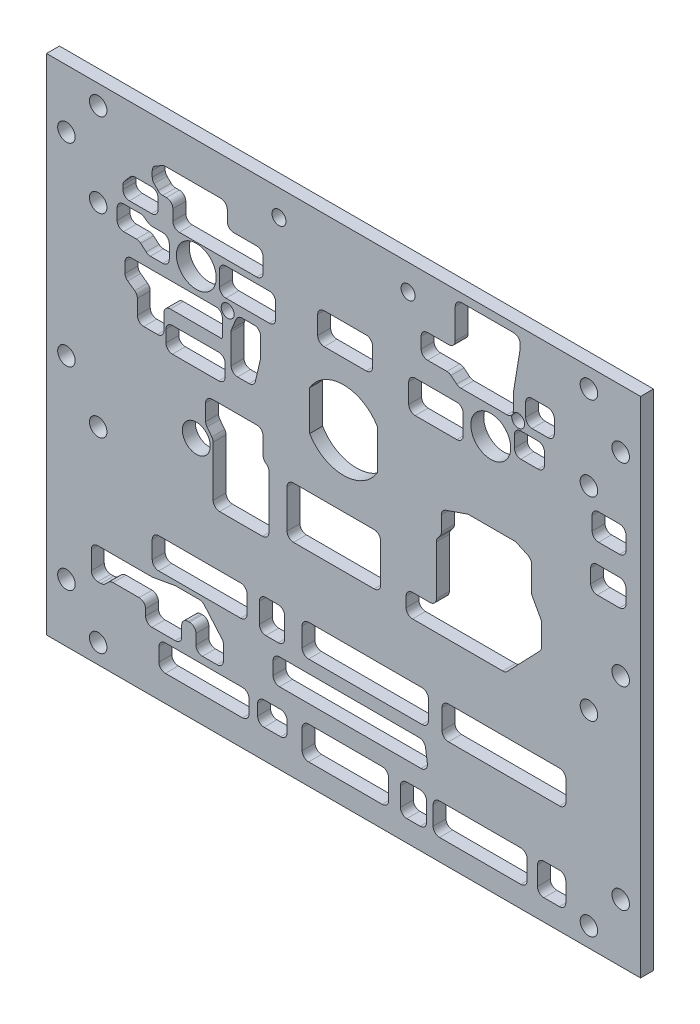
from build123d import *

# Parameters (mm, degrees)
SKETCH1_W                = 146.05
SKETCH1_H                = 123.825
BOSS_EXTRUDE1_DEPTH      = 3.175
F_6_CLEARANCE_HOLE1_D    = 4.3053
SKETCH4_R                = 4.9022
SKETCH4_R_2              = 3.7703125
SKETCH4_R_3              = 3.429
SKETCH4_R_4              = 1.125
SKETCH4_R_5              = 1.5875
SWITCH_MOUNT_HOLES_DEPTH = 192.502777395
F_4_CLEARANCE_HOLE1_D    = 3.4544
CUT_EXTRUDE1_DEPTH       = 192.502777395
CUT_EXTRUDE1_DEPTH_BACK  = 192.502777395


with BuildPart() as part:
    # Sketch1 → Boss-Extrude1 (new body)
    with BuildSketch(Plane.XY):
        with Locations((-73.025, 61.9125)):
            Rectangle(SKETCH1_W, SKETCH1_H)
    extrude(amount=-BOSS_EXTRUDE1_DEPTH)

    # #6 Clearance Hole1 (through all)
    with Locations(Plane(origin=(0, 0, -3.175), x_dir=(-1, 0, 0), z_dir=(0, 0, -1))):
        with Locations((12.7, 119.0625), (133.35, 119.0625), (141.1605, 109.5375), (133.35, 98.425), (141.1605, 61.9125), (133.35, 50.673), (133.35, 4.7625), (12.7, 4.7625), (12.7, 50.673), (12.7, 98.425), (4.8895, 109.5375), (141.1605, 14.2875), (4.8895, 14.2875), (4.8895, 61.9125)):
            Hole(F_6_CLEARANCE_HOLE1_D / 2)

    # Sketch4 → Switch Mount Holes (cut, through all)
    with BuildSketch(Plane(origin=(0, 0, -3.175), x_dir=(-1, 0, 0), z_dir=(0, 0, -1))):
        with Locations((36.83, 96.901)):
            Circle(SKETCH4_R)
        with Locations((36.83, 60.325)):
            Circle(SKETCH4_R_2)
        with Locations((109.22, 60.325)):
            Circle(SKETCH4_R_3)
        with Locations((109.22, 96.901)):
            Circle(SKETCH4_R)
        with Locations((36.830000027, 66.525)):
            Circle(SKETCH4_R_4)
        with Locations((101.514113129, 91.302345472)):
            Circle(SKETCH4_R_5)
        with Locations((30.094807909, 103.636192091)):
            Circle(SKETCH4_R_5)
        with BuildLine():
            Line((81.3435, 85.032269324), (81.3435, 75.241730676))
            ThreePointArc((81.3435, 75.241730676), (73.025, 70.485), (64.7065, 75.241730676))
            Line((64.7065, 75.241730676), (64.7065, 85.032269324))
            ThreePointArc((64.7065, 85.032269324), (73.025, 89.789), (81.3435, 85.032269324))
        make_face()
    extrude(amount=-SWITCH_MOUNT_HOLES_DEPTH, mode=Mode.SUBTRACT)

    # #4 Clearance Hole1 (through all)
    with Locations(Plane.XY):
        with Locations((-88.9, 117.475), (-57.15, 117.475)):
            Hole(F_4_CLEARANCE_HOLE1_D / 2)

    # Sketch7 → Cut-Extrude1 (cut, two sides: drawn at the far end of the back side and taken through both)
    with BuildSketch(Plane(origin=(0, 0, -3.175), x_dir=(-1, 0, 0), z_dir=(0, 0, -1)).offset(-CUT_EXTRUDE1_DEPTH_BACK)):
        with BuildLine():
            Line((50.18834912, 55.657636326), (50.18834912, 67.777242905))
            ThreePointArc((50.18834912, 67.777242905), (50.107046721, 68.278765624), (49.871467182, 68.728918264))
            Line((49.871467182, 68.728918264), (49.27420426, 69.526346767))
            ThreePointArc((49.27420426, 69.526346767), (49.038624722, 69.976499407), (48.957322323, 70.478022126))
            Line((48.957322323, 70.478022126), (48.957322323, 74.149631653))
            ThreePointArc((48.957322323, 74.149631653), (48.662982402, 75.070442849), (47.889110343, 75.649797045))
            Line((47.889110343, 75.649797045), (42.669307529, 77.456651865))
            ThreePointArc((42.669307529, 77.456651865), (42.413309929, 77.522000575), (42.150019509, 77.543986473))
            Line((42.150019509, 77.543986473), (31.103079312, 77.543986473))
            ThreePointArc((31.103079312, 77.543986473), (30.770451883, 77.508747805), (30.452591507, 77.404596229))
            Line((30.452591507, 77.404596229), (27.739916618, 76.186068472))
            ThreePointArc((27.739916618, 76.186068472), (27.057586798, 75.60037012), (26.802904423, 74.737958716))
            Line((26.802904423, 74.737958716), (26.802904423, 68.713762689))
            ThreePointArc((26.802904423, 68.713762689), (26.752954373, 68.31867232), (26.606247542, 67.948444671))
            Line((26.606247542, 67.948444671), (24.53833852, 64.190350695))
            ThreePointArc((24.53833852, 64.190350695), (24.391631688, 63.820123046), (24.341681639, 63.425032677))
            Line((24.341681639, 63.425032677), (24.341681639, 58.319523275))
            ThreePointArc((24.341681639, 58.319523275), (24.456196184, 57.727518124), (24.783218772, 57.220921729))
            Line((24.783218772, 57.220921729), (32.746973693, 48.913844929))
            ThreePointArc((32.746973693, 48.913844929), (33.269989413, 48.552277615), (33.89293656, 48.424946476))
            Line((33.89293656, 48.424946476), (56.063879571, 48.424946476))
            ThreePointArc((56.063879571, 48.424946476), (57.186411586, 48.88991446), (57.651379571, 50.012446476))
            Line((57.651379571, 50.012446476), (57.651379571, 52.482636326))
            ThreePointArc((57.651379571, 52.482636326), (57.186411586, 53.605168341), (56.063879571, 54.070136326))
            Line((56.063879571, 54.070136326), (51.77584912, 54.070136326))
            ThreePointArc((51.77584912, 54.070136326), (50.653317105, 54.535104311), (50.18834912, 55.657636326))
        make_face()
        with BuildLine():
            Line((5.181158483, 94.094392119), (10.325970848, 94.094392119))
            ThreePointArc((10.325970848, 94.094392119), (11.448502863, 93.629424134), (11.913470848, 92.506892119))
            Line((11.913470848, 92.506892119), (11.913470848, 89.208593094))
            ThreePointArc((11.913470848, 89.208593094), (11.448502863, 88.086061079), (10.325970848, 87.621093094))
            Line((10.325970848, 87.621093094), (5.181158483, 87.621093094))
            ThreePointArc((5.181158483, 87.621093094), (4.058626468, 88.086061079), (3.593658483, 89.208593094))
            Line((3.593658483, 89.208593094), (3.593658483, 92.506892119))
            ThreePointArc((3.593658483, 92.506892119), (4.058626468, 93.629424134), (5.181158483, 94.094392119))
        make_face()
        with BuildLine():
            Line((5.181158483, 82.731422736), (10.674837859, 82.731422736))
            ThreePointArc((10.674837859, 82.731422736), (11.797369874, 82.266454751), (12.262337859, 81.143922736))
            Line((12.262337859, 81.143922736), (12.262337859, 77.807980754))
            ThreePointArc((12.262337859, 77.807980754), (11.797369874, 76.685448739), (10.674837859, 76.220480754))
            Line((10.674837859, 76.220480754), (5.181158483, 76.220480754))
            ThreePointArc((5.181158483, 76.220480754), (4.058626468, 76.685448739), (3.593658483, 77.807980754))
            Line((3.593658483, 77.807980754), (3.593658483, 81.143922736))
            ThreePointArc((3.593658483, 81.143922736), (4.058626468, 82.266454751), (5.181158483, 82.731422736))
        make_face()
        with BuildLine():
            Line((65.508805493, 62.722267528), (85.328907255, 62.722267528))
            ThreePointArc((85.328907255, 62.722267528), (86.45143927, 62.257299543), (86.916407255, 61.134767528))
            Line((86.916407255, 61.134767528), (86.916407255, 51.680070799))
            ThreePointArc((86.916407255, 51.680070799), (86.45143927, 50.557538784), (85.328907255, 50.092570799))
            Line((85.328907255, 50.092570799), (65.508805493, 50.092570799))
            ThreePointArc((65.508805493, 50.092570799), (64.386273478, 50.557538784), (63.921305493, 51.680070799))
            Line((63.921305493, 51.680070799), (63.921305493, 61.134767528))
            ThreePointArc((63.921305493, 61.134767528), (64.386273478, 62.257299543), (65.508805493, 62.722267528))
        make_face()
        with BuildLine():
            Line((45.564358924, 120.203016735), (45.564358924, 112.844721983))
            ThreePointArc((45.564358924, 112.844721983), (46.029326909, 111.722189968), (47.151858924, 111.257221983))
            Line((47.151858924, 111.257221983), (52.364158125, 111.257221983))
            ThreePointArc((52.364158125, 111.257221983), (53.48669014, 110.792253998), (53.951658125, 109.669721983))
            Line((53.951658125, 109.669721983), (53.951658125, 106.935488455))
            ThreePointArc((53.951658125, 106.935488455), (53.48669014, 105.81295644), (52.364158125, 105.347988455))
            Line((52.364158125, 105.347988455), (47.596882261, 105.347988455))
            ThreePointArc((47.596882261, 105.347988455), (47.067081482, 105.256973465), (46.598030073, 104.994364688))
            Line((46.598030073, 104.994364688), (45.184243557, 103.849870841))
            ThreePointArc((45.184243557, 103.849870841), (44.715192148, 103.587262064), (44.185391369, 103.496247073))
            Line((44.185391369, 103.496247073), (32.882557687, 103.496247073))
            ThreePointArc((32.882557687, 103.496247073), (31.760025672, 103.961215058), (31.295057687, 105.083747073))
            Line((31.295057687, 105.083747073), (31.295057687, 108.776562398))
            ThreePointArc((31.295057687, 108.776562398), (31.289723416, 108.906592612), (31.273756451, 109.035748978))
            Line((31.273756451, 109.035748978), (29.621602318, 119.019297379))
            ThreePointArc((29.621602318, 119.019297379), (29.605635353, 119.148453745), (29.600301082, 119.278483959))
            Line((29.600301082, 119.278483959), (29.600301082, 120.203016735))
            ThreePointArc((29.600301082, 120.203016735), (30.065269067, 121.32554875), (31.187801082, 121.790516735))
            Line((31.187801082, 121.790516735), (43.976858924, 121.790516735))
            ThreePointArc((43.976858924, 121.790516735), (45.099390939, 121.32554875), (45.564358924, 120.203016735))
        make_face()
        with BuildLine():
            Line((22.787445939, 110.069830262), (26.670049045, 110.069830262))
            ThreePointArc((26.670049045, 110.069830262), (27.79258106, 109.604862277), (28.257549045, 108.482330262))
            Line((28.257549045, 108.482330262), (28.257549045, 105.246871668))
            ThreePointArc((28.257549045, 105.246871668), (27.79258106, 104.124339653), (26.670049045, 103.659371668))
            Line((26.670049045, 103.659371668), (22.787445939, 103.659371668))
            ThreePointArc((22.787445939, 103.659371668), (21.664913924, 104.124339653), (21.199945939, 105.246871668))
            Line((21.199945939, 105.246871668), (21.199945939, 108.482330262))
            ThreePointArc((21.199945939, 108.482330262), (21.664913924, 109.604862277), (22.787445939, 110.069830262))
        make_face()
        with BuildLine():
            Line((31.02539325, 97.33297453), (31.02539325, 100.162093978))
            ThreePointArc((31.02539325, 100.162093978), (30.560425265, 101.284625993), (29.43789325, 101.749593978))
            Line((29.43789325, 101.749593978), (25.217090486, 101.749593978))
            ThreePointArc((25.217090486, 101.749593978), (24.09455847, 101.284625993), (23.629590486, 100.162093978))
            Line((23.629590486, 100.162093978), (23.629590486, 97.33297453))
            ThreePointArc((23.629590486, 97.33297453), (24.09455847, 96.210442514), (25.217090486, 95.74547453))
            Line((25.217090486, 95.74547453), (29.43789325, 95.74547453))
            ThreePointArc((29.43789325, 95.74547453), (30.560425265, 96.210442514), (31.02539325, 97.33297453))
        make_face()
        with BuildLine():
            Line((45.19359616, 100.012899305), (55.41244775, 100.012899305))
            ThreePointArc((55.41244775, 100.012899305), (56.534979765, 99.547931321), (56.99994775, 98.425399305))
            Line((56.99994775, 98.425399305), (56.99994775, 93.629903233))
            ThreePointArc((56.99994775, 93.629903233), (56.534979765, 92.507371218), (55.41244775, 92.042403233))
            Line((55.41244775, 92.042403233), (45.19359616, 92.042403233))
            ThreePointArc((45.19359616, 92.042403233), (44.071064145, 92.507371218), (43.60609616, 93.629903233))
            Line((43.60609616, 93.629903233), (43.60609616, 98.425399305))
            ThreePointArc((43.60609616, 98.425399305), (44.071064145, 99.547931321), (45.19359616, 100.012899305))
        make_face()
        with BuildLine():
            Line((67.466131008, 103.181910767), (77.797089813, 103.181910767))
            ThreePointArc((77.797089813, 103.181910767), (78.919621828, 102.716942782), (79.384589813, 101.594410767))
            Line((79.384589813, 101.594410767), (79.384589813, 97.111483917))
            ThreePointArc((79.384589813, 97.111483917), (78.919621828, 95.988951902), (77.797089813, 95.523983917))
            Line((77.797089813, 95.523983917), (67.466131008, 95.523983917))
            ThreePointArc((67.466131008, 95.523983917), (66.343598993, 95.988951902), (65.878631008, 97.111483917))
            Line((65.878631008, 97.111483917), (65.878631008, 101.594410767))
            ThreePointArc((65.878631008, 101.594410767), (66.343598993, 102.716942782), (67.466131008, 103.181910767))
        make_face()
        with BuildLine():
            Line((101.611294319, 112.82046171), (101.611294319, 110.269232639))
            ThreePointArc((101.611294319, 110.269232639), (101.146326335, 109.146700624), (100.023794319, 108.681732639))
            Line((100.023794319, 108.681732639), (94.373996002, 108.681732639))
            ThreePointArc((94.373996002, 108.681732639), (93.251463987, 108.216764654), (92.786496002, 107.094232639))
            Line((92.786496002, 107.094232639), (92.786496002, 103.659395041))
            ThreePointArc((92.786496002, 103.659395041), (93.251463987, 102.536863026), (94.373996002, 102.071895041))
            Line((94.373996002, 102.071895041), (113.398682582, 102.071895041))
            ThreePointArc((113.398682582, 102.071895041), (114.521214598, 102.536863026), (114.986182582, 103.659395041))
            Line((114.986182582, 103.659395041), (114.986182582, 106.295223931))
            ThreePointArc((114.986182582, 106.295223931), (115.451150567, 107.417755946), (116.573682582, 107.882723931))
            Line((116.573682582, 107.882723931), (117.48214533, 107.882723931))
            ThreePointArc((117.48214533, 107.882723931), (118.089655278, 108.003565173), (118.604677345, 108.347691916))
            Line((118.604677345, 108.347691916), (119.594029658, 109.33704423))
            ThreePointArc((119.594029658, 109.33704423), (119.938156401, 109.852066296), (120.058997643, 110.459576245))
            Line((120.058997643, 110.459576245), (120.058997643, 111.887356452))
            ThreePointArc((120.058997643, 111.887356452), (119.837562605, 112.696073195), (119.235031948, 113.279179578))
            Line((119.235031948, 113.279179578), (117.534103161, 114.212284837))
            ThreePointArc((117.534103161, 114.212284837), (117.164673561, 114.358264601), (116.770568856, 114.40796171))
            Line((116.770568856, 114.40796171), (103.198794319, 114.40796171))
            ThreePointArc((103.198794319, 114.40796171), (102.076262304, 113.942993725), (101.611294319, 112.82046171))
        make_face()
        with BuildLine():
            Line((118.610592949, 106.776009621), (118.610592949, 104.232306918))
            ThreePointArc((118.610592949, 104.232306918), (119.075560934, 103.109774903), (120.198092949, 102.644806918))
            Line((120.198092949, 102.644806918), (125.677210265, 102.644806918))
            ThreePointArc((125.677210265, 102.644806918), (126.79974228, 103.109774903), (127.264710265, 104.232306918))
            Line((127.264710265, 104.232306918), (127.264710265, 105.18540984))
            ThreePointArc((127.264710265, 105.18540984), (127.164648812, 105.740101482), (126.877078368, 106.224867768))
            Line((126.877078368, 106.224867768), (125.484617073, 107.832215065))
            ThreePointArc((125.484617073, 107.832215065), (124.941340431, 108.238109655), (124.278243295, 108.380243805))
            Line((124.278243295, 108.380243805), (120.191587274, 108.36349629))
            ThreePointArc((120.191587274, 108.36349629), (119.073263182, 107.896239171), (118.610592949, 106.776009621))
        make_face()
        with BuildLine():
            Line((128.687272235, 99.676651671), (128.687272235, 96.955696069))
            ThreePointArc((128.687272235, 96.955696069), (128.22230425, 95.833164054), (127.099772235, 95.368196069))
            Line((127.099772235, 95.368196069), (123.928164631, 95.368196069))
            ThreePointArc((123.928164631, 95.368196069), (123.373472988, 95.268134617), (122.888706702, 94.980564172))
            Line((122.888706702, 94.980564172), (121.545202914, 93.81667319))
            ThreePointArc((121.545202914, 93.81667319), (121.060436627, 93.529102745), (120.505744985, 93.429041293))
            Line((120.505744985, 93.429041293), (117.462157999, 93.429041293))
            ThreePointArc((117.462157999, 93.429041293), (116.339625983, 93.894009277), (115.874657999, 95.016541293))
            Line((115.874657999, 95.016541293), (115.874657999, 98.381062929))
            ThreePointArc((115.874657999, 98.381062929), (116.339625983, 99.503594944), (117.462157999, 99.968562929))
            Line((117.462157999, 99.968562929), (120.097265497, 99.968562929))
            ThreePointArc((120.097265497, 99.968562929), (120.560066486, 100.037520373), (120.982661399, 100.238401991))
            Line((120.982661399, 100.238401991), (122.107620179, 100.994312609))
            ThreePointArc((122.107620179, 100.994312609), (122.530215091, 101.195194227), (122.993016081, 101.264151671))
            Line((122.993016081, 101.264151671), (127.099772235, 101.264151671))
            ThreePointArc((127.099772235, 101.264151671), (128.22230425, 100.799183686), (128.687272235, 99.676651671))
        make_face()
        with BuildLine():
            Line((91.293171593, 100.629248984), (101.949222111, 100.629248984))
            ThreePointArc((101.949222111, 100.629248984), (103.071754127, 100.164281), (103.536722111, 99.041748984))
            Line((103.536722111, 99.041748984), (103.536722111, 95.367101962))
            ThreePointArc((103.536722111, 95.367101962), (103.071754127, 94.244569947), (101.949222111, 93.779601962))
            Line((101.949222111, 93.779601962), (91.293171593, 93.779601962))
            ThreePointArc((91.293171593, 93.779601962), (90.170639578, 94.244569947), (89.705671593, 95.367101962))
            Line((89.705671593, 95.367101962), (89.705671593, 99.041748984))
            ThreePointArc((89.705671593, 99.041748984), (90.170639578, 100.164281), (91.293171593, 100.629248984))
        make_face()
        with BuildLine():
            Line((93.387492572, 89.930312957), (93.387492572, 85.507228248))
            ThreePointArc((93.387492572, 85.507228248), (93.397869235, 85.326015032), (93.42886357, 85.147170809))
            Line((93.42886357, 85.147170809), (94.705096955, 79.66687451))
            ThreePointArc((94.705096955, 79.66687451), (95.264168445, 78.783600248), (96.251225957, 78.439431948))
            Line((96.251225957, 78.439431948), (99.08691564, 78.439431948))
            ThreePointArc((99.08691564, 78.439431948), (100.209447655, 78.904399933), (100.67441564, 80.026931948))
            Line((100.67441564, 80.026931948), (100.67441564, 87.257929966))
            ThreePointArc((100.67441564, 87.257929966), (100.643498958, 87.569706524), (100.551953124, 87.869339338))
            Line((100.551953124, 87.869339338), (99.436677901, 90.541722329))
            ThreePointArc((99.436677901, 90.541722329), (98.851851719, 91.251442895), (97.971640417, 91.517812957))
            Line((97.971640417, 91.517812957), (94.974992572, 91.517812957))
            ThreePointArc((94.974992572, 91.517812957), (93.852460557, 91.052844972), (93.387492572, 89.930312957))
        make_face()
        with BuildLine():
            Line((116.688392685, 76.867531359), (116.688392685, 79.800128653))
            ThreePointArc((116.688392685, 79.800128653), (116.223424701, 80.922660668), (115.100892685, 81.387628653))
            Line((115.100892685, 81.387628653), (103.716466167, 81.387628653))
            ThreePointArc((103.716466167, 81.387628653), (102.593934152, 80.922660668), (102.128966167, 79.800128653))
            Line((102.128966167, 79.800128653), (102.128966167, 76.867531359))
            ThreePointArc((102.128966167, 76.867531359), (102.593934152, 75.744999344), (103.716466167, 75.280031359))
            Line((103.716466167, 75.280031359), (115.100892685, 75.280031359))
            ThreePointArc((115.100892685, 75.280031359), (116.223424701, 75.744999344), (116.688392685, 76.867531359))
        make_face()
        with BuildLine():
            Line((118.764909826, 77.640146273), (122.135778264, 77.640146273))
            ThreePointArc((122.135778264, 77.640146273), (123.258310279, 78.105114258), (123.723278264, 79.227646273))
            Line((123.723278264, 79.227646273), (123.723278264, 82.859296988))
            ThreePointArc((123.723278264, 82.859296988), (123.897566051, 83.582475727), (124.382160141, 84.146862377))
            Line((124.382160141, 84.146862377), (126.082428911, 85.3731305))
            ThreePointArc((126.082428911, 85.3731305), (126.567023002, 85.93751715), (126.741310788, 86.66069589))
            Line((126.741310788, 86.66069589), (126.741310788, 89.120611646))
            ThreePointArc((126.741310788, 89.120611646), (126.276342803, 90.243143661), (125.153810788, 90.708111646))
            Line((125.153810788, 90.708111646), (104.39373318, 90.708111646))
            ThreePointArc((104.39373318, 90.708111646), (103.271201165, 90.243143661), (102.80623318, 89.120611646))
            Line((102.80623318, 89.120611646), (102.80623318, 85.25916348))
            ThreePointArc((102.80623318, 85.25916348), (102.836932853, 84.948472328), (102.927844509, 84.649797701))
            Line((102.927844509, 84.649797701), (115.589909826, 84.649797701))
            ThreePointArc((115.589909826, 84.649797701), (116.712441841, 84.184829716), (117.177409826, 83.062297701))
            Line((117.177409826, 83.062297701), (117.177409826, 79.227646273))
            ThreePointArc((117.177409826, 79.227646273), (117.64237781, 78.105114258), (118.764909826, 77.640146273))
        make_face()
        with BuildLine():
            Line((92.786496002, 68.980023049), (92.786496002, 64.828450761))
            ThreePointArc((92.786496002, 64.828450761), (92.601941715, 64.085551322), (92.091189448, 63.515382939))
            Line((92.091189448, 63.515382939), (92.068509245, 63.499972365))
            ThreePointArc((92.068509245, 63.499972365), (91.557756978, 62.929803983), (91.373202691, 62.186904543))
            Line((91.373202691, 62.186904543), (91.373202691, 49.151285781))
            ThreePointArc((91.373202691, 49.151285781), (91.838170676, 48.028753766), (92.960702691, 47.563785781))
            Line((92.960702691, 47.563785781), (103.498957618, 47.563785781))
            ThreePointArc((103.498957618, 47.563785781), (104.621489633, 48.028753766), (105.086457618, 49.151285781))
            Line((105.086457618, 49.151285781), (105.086457618, 61.53260679))
            ThreePointArc((105.086457618, 61.53260679), (105.171649911, 62.0456641), (105.418083197, 62.503655547))
            Line((105.418083197, 62.503655547), (106.603159399, 64.036335423))
            ThreePointArc((106.603159399, 64.036335423), (106.849592685, 64.49432687), (106.934784978, 65.00738418))
            Line((106.934784978, 65.00738418), (106.934784978, 68.980023049))
            ThreePointArc((106.934784978, 68.980023049), (106.469816993, 70.102555064), (105.347284978, 70.567523049))
            Line((105.347284978, 70.567523049), (94.373996002, 70.567523049))
            ThreePointArc((94.373996002, 70.567523049), (93.251463987, 70.102555064), (92.786496002, 68.980023049))
        make_face()
        with BuildLine():
            Line((19.931702371, 34.721381606), (47.228693551, 34.721381606))
            ThreePointArc((47.228693551, 34.721381606), (48.351225566, 34.256413621), (48.816193551, 33.133881606))
            Line((48.816193551, 33.133881606), (48.816193551, 28.259341128))
            ThreePointArc((48.816193551, 28.259341128), (48.351225566, 27.136809112), (47.228693551, 26.671841128))
            Line((47.228693551, 26.671841128), (19.931702371, 26.671841128))
            ThreePointArc((19.931702371, 26.671841128), (18.809170356, 27.136809112), (18.344202371, 28.259341128))
            Line((18.344202371, 28.259341128), (18.344202371, 33.133881606))
            ThreePointArc((18.344202371, 33.133881606), (18.809170356, 34.256413621), (19.931702371, 34.721381606))
        make_face()
        with BuildLine():
            Line((52.153674145, 33.360656817), (52.153674145, 28.70185114))
            ThreePointArc((52.153674145, 28.70185114), (52.61864213, 27.579319125), (53.741174145, 27.11435114))
            Line((53.741174145, 27.11435114), (81.622187277, 27.11435114))
            ThreePointArc((81.622187277, 27.11435114), (82.744719292, 27.579319125), (83.209687277, 28.70185114))
            Line((83.209687277, 28.70185114), (83.209687277, 33.360656817))
            ThreePointArc((83.209687277, 33.360656817), (82.744719292, 34.483188832), (81.622187277, 34.948156817))
            Line((81.622187277, 34.948156817), (53.741174145, 34.948156817))
            ThreePointArc((53.741174145, 34.948156817), (52.61864213, 34.483188832), (52.153674145, 33.360656817))
        make_face()
        with BuildLine():
            Line((89.085683575, 34.948156817), (92.133583332, 34.948156817))
            ThreePointArc((92.133583332, 34.948156817), (93.256115347, 34.483188832), (93.721083332, 33.360656817))
            Line((93.721083332, 33.360656817), (93.721083332, 28.427232591))
            ThreePointArc((93.721083332, 28.427232591), (93.256115347, 27.304700576), (92.133583332, 26.839732591))
            Line((92.133583332, 26.839732591), (89.085683575, 26.839732591))
            ThreePointArc((89.085683575, 26.839732591), (87.96315156, 27.304700576), (87.498183575, 28.427232591))
            Line((87.498183575, 28.427232591), (87.498183575, 33.360656817))
            ThreePointArc((87.498183575, 33.360656817), (87.96315156, 34.483188832), (89.085683575, 34.948156817))
        make_face()
        with BuildLine():
            Line((98.324752654, 34.948156817), (118.471497643, 34.948156817))
            ThreePointArc((118.471497643, 34.948156817), (119.594029658, 34.483188832), (120.058997643, 33.360656817))
            Line((120.058997643, 33.360656817), (120.058997643, 29.033526732))
            ThreePointArc((120.058997643, 29.033526732), (119.594029658, 27.910994717), (118.471497643, 27.446026732))
            Line((118.471497643, 27.446026732), (98.324752654, 27.446026732))
            ThreePointArc((98.324752654, 27.446026732), (97.202220639, 27.910994717), (96.737252654, 29.033526732))
            Line((96.737252654, 29.033526732), (96.737252654, 33.360656817))
            ThreePointArc((96.737252654, 33.360656817), (97.202220639, 34.483188832), (98.324752654, 34.948156817))
        make_face()
        with BuildLine():
            Line((130.809930978, 18.879921581), (131.574234723, 18.115617837))
            ThreePointArc((131.574234723, 18.115617837), (132.089256789, 17.771491094), (132.696766738, 17.650649852))
            Line((132.696766738, 17.650649852), (133.444859535, 17.650649852))
            ThreePointArc((133.444859535, 17.650649852), (134.56739155, 18.115617837), (135.032359535, 19.238149852))
            Line((135.032359535, 19.238149852), (135.032359535, 23.743703221))
            ThreePointArc((135.032359535, 23.743703221), (134.56739155, 24.866235236), (133.444859535, 25.331203221))
            Line((133.444859535, 25.331203221), (120.198043242, 25.331203221))
            ThreePointArc((120.198043242, 25.331203221), (120.059527946, 25.337257755), (119.922069212, 25.355375173))
            Line((119.922069212, 25.355375173), (114.51267504, 26.310294592))
            ThreePointArc((114.51267504, 26.310294592), (114.375216306, 26.328412011), (114.23670101, 26.334466545))
            Line((114.23670101, 26.334466545), (108.463538342, 26.334466545))
            ThreePointArc((108.463538342, 26.334466545), (107.801837506, 26.189987076), (107.260580368, 25.782847022))
            Line((107.260580368, 25.782847022), (102.930758932, 20.75466729))
            ThreePointArc((102.930758932, 20.75466729), (102.645454155, 20.271263268), (102.546216906, 19.718786813))
            Line((102.546216906, 19.718786813), (102.546216906, 16.230122085))
            ThreePointArc((102.546216906, 16.230122085), (103.011184891, 15.10759007), (104.133716906, 14.642622085))
            Line((104.133716906, 14.642622085), (107.717351819, 14.642622085))
            ThreePointArc((107.717351819, 14.642622085), (108.839883834, 15.10759007), (109.304851819, 16.230122085))
            Line((109.304851819, 16.230122085), (109.304851819, 18.720602356))
            ThreePointArc((109.304851819, 18.720602356), (109.769819803, 19.843134371), (110.892351819, 20.308102356))
            Line((110.892351819, 20.308102356), (111.225855893, 20.308102356))
            ThreePointArc((111.225855893, 20.308102356), (112.348387909, 19.843134371), (112.813355893, 18.720602356))
            Line((112.813355893, 18.720602356), (112.813355893, 16.20758336))
            ThreePointArc((112.813355893, 16.20758336), (113.278323878, 15.085051344), (114.400855893, 14.62008336))
            Line((114.400855893, 14.62008336), (120.113650849, 14.62008336))
            ThreePointArc((120.113650849, 14.62008336), (121.236182864, 15.085051344), (121.701150849, 16.20758336))
            Line((121.701150849, 16.20758336), (121.701150849, 17.757389566))
            ThreePointArc((121.701150849, 17.757389566), (122.166118834, 18.879921581), (123.288650849, 19.344889566))
            Line((123.288650849, 19.344889566), (129.687398963, 19.344889566))
            ThreePointArc((129.687398963, 19.344889566), (130.294908912, 19.224048323), (130.809930978, 18.879921581))
        make_face()
        with BuildLine():
            Line((54.437661962, 23.987563514), (88.766712018, 23.987563514))
            ThreePointArc((88.766712018, 23.987563514), (89.889244033, 23.522595529), (90.354212018, 22.400063514))
            Line((90.354212018, 22.400063514), (90.354212018, 19.217218273))
            ThreePointArc((90.354212018, 19.217218273), (89.889244033, 18.094686257), (88.766712018, 17.629718273))
            Line((88.766712018, 17.629718273), (53.98367537, 17.629718273))
            ThreePointArc((53.98367537, 17.629718273), (52.784505211, 18.176955238), (52.41208181, 19.441383242))
            Line((52.41208181, 19.441383242), (52.866068403, 22.624228483))
            ThreePointArc((52.866068403, 22.624228483), (53.397398928, 23.599233673), (54.437661962, 23.987563514))
        make_face()
        with BuildLine():
            Line((19.972044791, 12.983444079), (23.772984138, 12.983444079))
            ThreePointArc((23.772984138, 12.983444079), (24.895516153, 12.518476094), (25.360484138, 11.395944079))
            Line((25.360484138, 11.395944079), (25.360484138, 6.804113873))
            ThreePointArc((25.360484138, 6.804113873), (24.895516153, 5.681581857), (23.772984138, 5.216613873))
            Line((23.772984138, 5.216613873), (19.972044791, 5.216613873))
            ThreePointArc((19.972044791, 5.216613873), (18.849512776, 5.681581857), (18.384544791, 6.804113873))
            Line((18.384544791, 6.804113873), (18.384544791, 11.395944079))
            ThreePointArc((18.384544791, 11.395944079), (18.849512776, 12.518476094), (19.972044791, 12.983444079))
        make_face()
        with BuildLine():
            Line((29.460667188, 12.983444079), (49.41798254, 12.983444079))
            ThreePointArc((49.41798254, 12.983444079), (50.540514555, 12.518476094), (51.00548254, 11.395944079))
            Line((51.00548254, 11.395944079), (51.00548254, 6.804113873))
            ThreePointArc((51.00548254, 6.804113873), (50.540514555, 5.681581857), (49.41798254, 5.216613873))
            Line((49.41798254, 5.216613873), (29.460667188, 5.216613873))
            ThreePointArc((29.460667188, 5.216613873), (28.338135173, 5.681581857), (27.873167188, 6.804113873))
            Line((27.873167188, 6.804113873), (27.873167188, 11.395944079))
            ThreePointArc((27.873167188, 11.395944079), (28.338135173, 12.518476094), (29.460667188, 12.983444079))
        make_face()
        with BuildLine():
            Line((54.194601233, 12.983444079), (57.465463725, 12.983444079))
            ThreePointArc((57.465463725, 12.983444079), (58.587995741, 12.518476094), (59.052963725, 11.395944079))
            Line((59.052963725, 11.395944079), (59.052963725, 6.804113873))
            ThreePointArc((59.052963725, 6.804113873), (58.587995741, 5.681581857), (57.465463725, 5.216613873))
            Line((57.465463725, 5.216613873), (54.194601233, 5.216613873))
            ThreePointArc((54.194601233, 5.216613873), (53.072069218, 5.681581857), (52.607101233, 6.804113873))
            Line((52.607101233, 6.804113873), (52.607101233, 11.395944079))
            ThreePointArc((52.607101233, 11.395944079), (53.072069218, 12.518476094), (54.194601233, 12.983444079))
        make_face()
        with BuildLine():
            Line((63.523824133, 13.258596439), (81.612584149, 13.258596439))
            ThreePointArc((81.612584149, 13.258596439), (82.735116164, 12.793628455), (83.200084149, 11.671096439))
            Line((83.200084149, 11.671096439), (83.200084149, 6.804113873))
            ThreePointArc((83.200084149, 6.804113873), (82.735116164, 5.681581857), (81.612584149, 5.216613873))
            Line((81.612584149, 5.216613873), (63.523824133, 5.216613873))
            ThreePointArc((63.523824133, 5.216613873), (62.401292118, 5.681581857), (61.936324133, 6.804113873))
            Line((61.936324133, 6.804113873), (61.936324133, 11.671096439))
            ThreePointArc((61.936324133, 11.671096439), (62.401292118, 12.793628455), (63.523824133, 13.258596439))
        make_face()
        with BuildLine():
            Line((88.488716218, 12.938085998), (92.564494786, 12.938085998))
            ThreePointArc((92.564494786, 12.938085998), (93.687026802, 12.473118013), (94.151994786, 11.350585998))
            Line((94.151994786, 11.350585998), (94.151994786, 8.706792011))
            ThreePointArc((94.151994786, 8.706792011), (93.687026802, 7.584259996), (92.564494786, 7.119292011))
            Line((92.564494786, 7.119292011), (88.488716218, 7.119292011))
            ThreePointArc((88.488716218, 7.119292011), (87.366184203, 7.584259996), (86.901216218, 8.706792011))
            Line((86.901216218, 8.706792011), (86.901216218, 11.350585998))
            ThreePointArc((86.901216218, 11.350585998), (87.366184203, 12.473118013), (88.488716218, 12.938085998))
        make_face()
        with BuildLine():
            Line((97.858509497, 12.938085998), (116.836269209, 12.938085998))
            ThreePointArc((116.836269209, 12.938085998), (117.958801224, 12.473118013), (118.423769209, 11.350585998))
            Line((118.423769209, 11.350585998), (118.423769209, 8.041438591))
            ThreePointArc((118.423769209, 8.041438591), (117.958801224, 6.918906576), (116.836269209, 6.453938591))
            Line((116.836269209, 6.453938591), (97.858509497, 6.453938591))
            ThreePointArc((97.858509497, 6.453938591), (96.735977482, 6.918906576), (96.271009497, 8.041438591))
            Line((96.271009497, 8.041438591), (96.271009497, 11.350585998))
            ThreePointArc((96.271009497, 11.350585998), (96.735977482, 12.473118013), (97.858509497, 12.938085998))
        make_face()
    extrude(amount=CUT_EXTRUDE1_DEPTH + CUT_EXTRUDE1_DEPTH_BACK, mode=Mode.SUBTRACT)


solid = part.part
